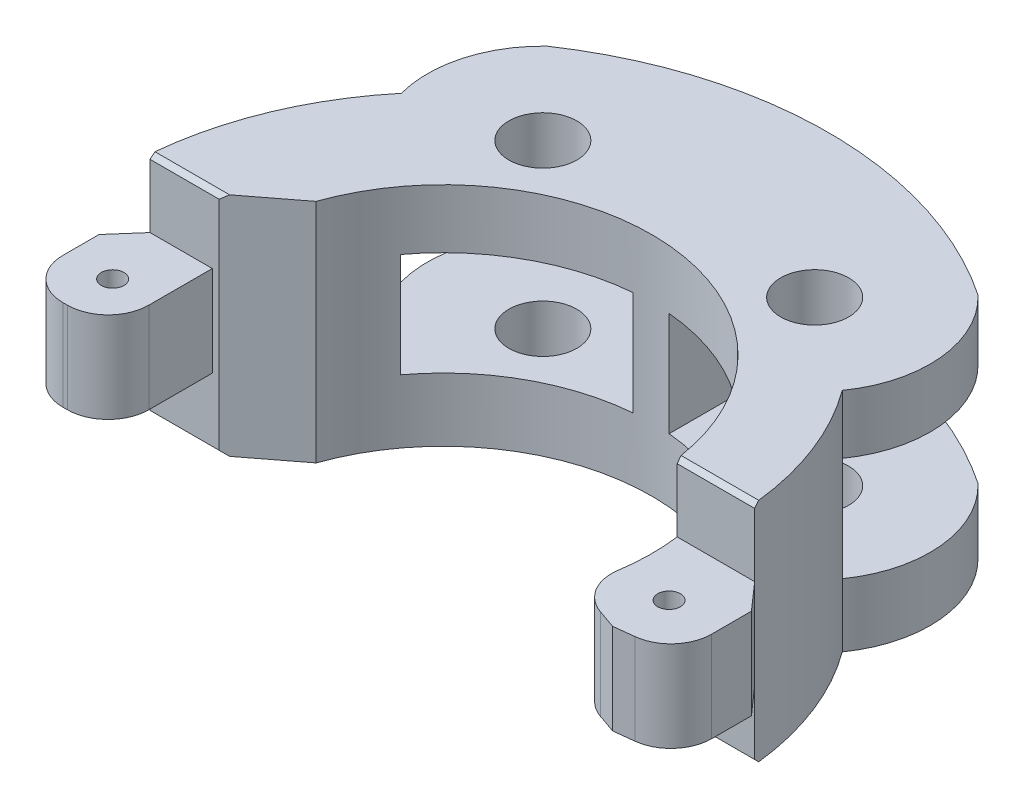
from build123d import *

# Parameters (mm, degrees)
BOSS_EXTRUDE1_DEPTH      = 5
BOSS_EXTRUDE1_DEPTH_BACK = 5
BOSS_EXTRUDE2_DEPTH      = 2
BOSS_EXTRUDE2_DEPTH_BACK = 2
SKETCH1_3_R              = 0.5
CHAMFER1_SIZE            = 1.974397617
FILLET1_R                = 1.8
CHAMFER2_SIZE            = 0.2
BOSS_EXTRUDE3_START      = -5
BOSS_EXTRUDE3_DEPTH      = 10
CUT_EXTRUDE1_START       = -2.2
CUT_EXTRUDE1_OUTLINE_R   = 1.5
CUT_EXTRUDE1_DEPTH       = 4.6
CUT_EXTRUDE2_DEPTH       = 24.34609175
CUT_EXTRUDE2_DEPTH_BACK  = 24.34609175
SKETCH3_4_R              = 1.5
CHAMFER3_SIZE            = 0.2
CHAMFER4_SIZE            = 0.879093368


with BuildPart() as part:
    # Sketch1 → Boss-Extrude1 (new, two sides: drawn at the far end of the back side and taken through both)
    with BuildSketch(Plane(origin=(0, 0, 0), x_dir=(1, 0, 0), z_dir=(0, 1, 0)).offset(-BOSS_EXTRUDE1_DEPTH_BACK)):
        with BuildLine():
            ThreePointArc((-9.121403401, 1.2), (0, 9.2), (9.121403401, 1.2))
            Line((9.121403401, 1.2), (12.542726976, 1.2))
            ThreePointArc((12.542726976, 1.2), (11.397774814, 5.371287488), (8.909545443, 8.909545443))
            Line((8.909545443, 8.909545443), (7.963837169, 11.756585285))
            ThreePointArc((7.963837169, 11.756585285), (-6.117603026, 12.814637459), (-14.149204925, 1.2))
            Line((-14.149204925, 1.2), (-9.121403401, 1.2))
        make_face()
    extrude(amount=BOSS_EXTRUDE1_DEPTH + BOSS_EXTRUDE1_DEPTH_BACK)

    # Sketch1<3> → Boss-Extrude2 (add, two sides: drawn at the far end of the back side and taken through both)
    # profile 1 of 2: a face of its own
    with BuildSketch(Plane(origin=(0, 0, 0), x_dir=(1, 0, 0), z_dir=(0, 1, 0)).offset(-BOSS_EXTRUDE2_DEPTH_BACK)):
        Polygon((-11.4, -3.4), (-11.4, 1.2), (-14.149204925, 1.2), (-15.2, 0), (-15.2, -3.4), align=None)
        with Locations(Location((-13.2, -1.4, 0), (0, 0, 270))):
            Circle(SKETCH1_3_R, mode=Mode.SUBTRACT)
    # profile 2 of 2: a face of its own
    with BuildSketch(Plane(origin=(0, 0, 0), x_dir=(1, 0, 0), z_dir=(0, 1, 0)).offset(-BOSS_EXTRUDE2_DEPTH_BACK)):
        with BuildLine():
            ThreePointArc((9.121403401, 1.2), (9.162283589, -0.832201557), (8.755927173, -2.823781036))
            Line((8.755927173, -2.823781036), (11.11699974, -3.64230517))
            Line((11.11699974, -3.64230517), (13.6, -3.360604742))
            Line((13.6, -3.360604742), (13.6, 0))
            Line((13.6, 0), (12.542726976, 1.2))
            Line((12.542726976, 1.2), (9.121403401, 1.2))
        make_face()
        with Locations(Location((11.365493645, -1.4, 0), (0, 0, 270))):
            Circle(SKETCH1_3_R, mode=Mode.SUBTRACT)
    extrude(amount=BOSS_EXTRUDE2_DEPTH + BOSS_EXTRUDE2_DEPTH_BACK)

    # Chamfer1
    # the kernel refuses this chamfer: 1.974397617, 1.7 mm, written as the material it takes off along each edge
    with BuildSketch(Plane(origin=(-9.121403401, -10.094040977, -1.2), x_dir=(-1, 0, 0), z_dir=(0, 1, 0))) as chamfer1_piece_1:
        with BuildLine():
            Line((CHAMFER1_SIZE, 0), (-0.443747976, -1.855862617))
            ThreePointArc((-0.443747976, -1.855862617), (-0.180868647, -0.969524905), (0, 0))
            Line((0, 0), (CHAMFER1_SIZE, 0))
        make_face()
    extrude(amount=20.188081954, mode=Mode.SUBTRACT)

    # Fillet1
    fillet1_edges = [part.edges().sort_by_distance(p)[0] for p in [
        (8.755927173, 0, 2.823781036),
        (13.6, 0, 3.360604742),
        (-15.2, 0, 3.4),
        (-11.4, 0, 3.4),
    ]]
    fillet(fillet1_edges, radius=FILLET1_R)

    # Chamfer2
    chamfer2_edges = [part.edges().sort_by_distance(p)[0] for p in [
        (10.832065189, 5, -1.2),
        (-12.622502971, 5, -1.2),
    ]]
    chamfer(chamfer2_edges, length=CHAMFER2_SIZE)

    # Boss-Extrude3: read off the stored shape, not the designer's step
    # Boss-Extrude3 outline → Boss-Extrude3 (add)
    with BuildSketch(Plane(origin=(0, 0, 0), x_dir=(1, 0, 0), z_dir=(0, 1, 0)).offset(BOSS_EXTRUDE3_START)):
        with BuildLine():
            ThreePointArc((10.163659229, 7.447149191), (11.075788932, 10.888658263), (9.514234502, 14.088269654))
            ThreePointArc((9.514234502, 14.088269654), (0, 17), (-9.514234502, 14.088269654))
            ThreePointArc((-9.514234502, 14.088269654), (-10.909488785, 11.773217539), (-10.925669215, 9.070267483))
            ThreePointArc((-10.925669215, 9.070267483), (-1.999296901, 14.058549424), (7.963837169, 11.756585285))
            Line((7.963837169, 11.756585285), (8.909545443, 8.909545443))
            ThreePointArc((8.909545443, 8.909545443), (9.564592768, 8.202351199), (10.163659229, 7.447149191))
        make_face()
    extrude(amount=BOSS_EXTRUDE3_DEPTH)

    # Cut-Extrude1: read off the stored shape, not the designer's step
    # Cut-Extrude1 outline → Cut-Extrude1 (cut)
    # profile 1 of 2: a face of its own
    with BuildSketch(Plane(origin=(0, 0, 0), x_dir=(1, 0, 0), z_dir=(0, 1, 0)).offset(CUT_EXTRUDE1_START)):
        with BuildLine():
            ThreePointArc((-10.925669215, 9.070267483), (-9.629828713, 6.809799644), (-7.386560009, 5.484408011))
            ThreePointArc((-7.386560009, 5.484408011), (-4.487973836, 8.031070342), (-0.8, 9.16515139))
            Line((-0.8, 9.16515139), (-0.8, 12.76515139))
            Line((-0.8, 12.76515139), (-4.443774964, 16.408926353))
            ThreePointArc((-4.443774964, 16.408926353), (-7.074805223, 15.457914835), (-9.514234502, 14.088269654))
            ThreePointArc((-9.514234502, 14.088269654), (-10.909488785, 11.773217539), (-10.925669215, 9.070267483))
        make_face()
        with Locations((-6, 10.392304845)):
            Circle(CUT_EXTRUDE1_OUTLINE_R, mode=Mode.SUBTRACT)
    # profile 2 of 2: a face of its own
    with BuildSketch(Plane(origin=(0, 0, 0), x_dir=(1, 0, 0), z_dir=(0, 1, 0)).offset(CUT_EXTRUDE1_START)):
        with BuildLine():
            Line((0.8, 12.76515139), (0.8, 9.16515139))
            ThreePointArc((0.8, 9.16515139), (4.487973836, 8.031070342), (7.386560009, 5.484408011))
            ThreePointArc((7.386560009, 5.484408011), (8.943521978, 6.22749052), (10.163659229, 7.447149191))
            ThreePointArc((10.163659229, 7.447149191), (11.075788932, 10.888658263), (9.514234502, 14.088269654))
            ThreePointArc((9.514234502, 14.088269654), (7.074805223, 15.457914835), (4.443774964, 16.408926353))
            Line((4.443774964, 16.408926353), (0.8, 12.76515139))
        make_face()
        with Locations((6, 10.392304845)):
            Circle(CUT_EXTRUDE1_OUTLINE_R, mode=Mode.SUBTRACT)
    extrude(amount=CUT_EXTRUDE1_DEPTH, mode=Mode.SUBTRACT)

    # Sketch3<4> (on Top Plane) → Cut-Extrude2 (cut, two sides: drawn at the far end of the back side and taken through both)
    with BuildSketch(Plane(origin=(0, 0, 0), x_dir=(1, 0, 0), z_dir=(0, 1, 0)).offset(-CUT_EXTRUDE2_DEPTH_BACK)):
        with Locations(Location((-6, 10.392304845, 0), (0, 0, 270))):
            Circle(SKETCH3_4_R)
        with Locations(Location((6, 10.392304845, 0), (0, 0, 270))):
            Circle(SKETCH3_4_R)
    extrude(amount=CUT_EXTRUDE2_DEPTH + CUT_EXTRUDE2_DEPTH_BACK, mode=Mode.SUBTRACT)

    # Chamfer3
    chamfer3_edges = [part.edges().sort_by_distance(p)[0] for p in [
        (10.832065189, -5, -1.2),
        (-12.622502971, -5, -1.2),
    ]]
    chamfer(chamfer3_edges, length=CHAMFER3_SIZE)

    # Chamfer4
    # the kernel refuses this chamfer: 1.2, 0.879093368, 0.860893535 mm, written as the material it takes off along each edge
    with BuildSketch(Plane(origin=(-10.925669215, -2.2, -9.070267483), x_dir=(0.39004090041873263, 0, 0.9207975325773544), z_dir=(0, 1, 0))) as chamfer4_piece_1:
        with BuildLine():
            Line((1.40776743, 0), (0.416367157, -0.748890719))
            ThreePointArc((0.416367157, -0.748890719), (0.204153797, -0.380499927), (0, 0))
            ThreePointArc((0, 0), (0.723274519, -0.048770435), (1.40776743, 0))
        make_face()
    extrude(amount=4.6, mode=Mode.SUBTRACT)
    with BuildSketch(Plane(origin=(4.443774964, -2.2, -16.408926353), x_dir=(-0.9735942522545705, 0, -0.22828541779286665), z_dir=(0, 1, 0))) as chamfer4_piece_2:
        with BuildLine():
            Line((1.16103032, 0), (CHAMFER4_SIZE * 0.527012931132, CHAMFER4_SIZE * 0.849857264932))
            Line((CHAMFER4_SIZE * 0.527012931132, CHAMFER4_SIZE * 0.849857264932), (0, 0))
            ThreePointArc((0, 0), (0.596888963, -0.009906707), (1.16103032, 0))
        make_face()
    extrude(amount=4.6, mode=Mode.SUBTRACT)
    with BuildSketch(Plane(origin=(-4.443774964, -2.2, -16.408926353), x_dir=(0.9735942522545713, 0, -0.22828541779286343), z_dir=(0, 1, 0))) as chamfer4_piece_3:
        with BuildLine():
            Line((1.16103032, 0), (CHAMFER4_SIZE * 0.527012931132, -CHAMFER4_SIZE * 0.849857264932))
            Line((CHAMFER4_SIZE * 0.527012931132, -CHAMFER4_SIZE * 0.849857264932), (0, 0))
            ThreePointArc((0, 0), (0.596888963, 0.009906707), (1.16103032, 0))
        make_face()
    extrude(amount=4.6, mode=Mode.SUBTRACT)


solid = part.part
